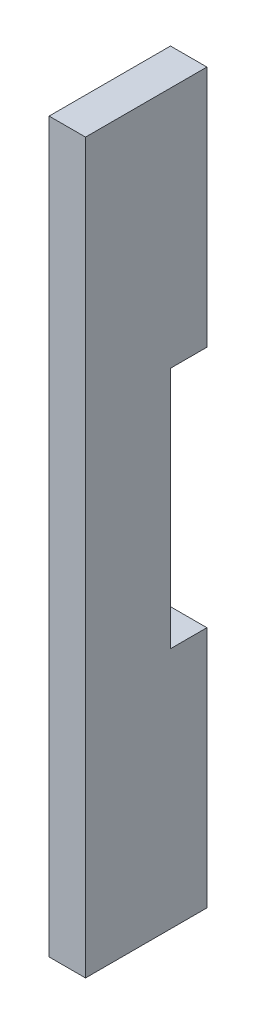
from build123d import *

# Parameters (mm, degrees)
CROQUIS1_W              = 20
CROQUIS1_H              = 120
SALIENTE_EXTRUIR1_DEPTH = 6
CROQUIS3_W              = 6.02
CROQUIS3_H              = 40.02
CORTAR_EXTRUIR1_DEPTH   = 122.803119829


with BuildPart() as part:
    # Croquis1 → Saliente-Extruir1 (new body)
    with BuildSketch(Plane(origin=(0, 0, 0), x_dir=(0, 0, -1), z_dir=(1, 0, 0))):
        with Locations((10, 60)):
            Rectangle(CROQUIS1_W, CROQUIS1_H)
    extrude(amount=SALIENTE_EXTRUIR1_DEPTH)

    # Croquis3 → Cortar-Extruir1 (cut, through all)
    with BuildSketch(Plane(origin=(0, 0, 0), x_dir=(0, 0, -1), z_dir=(1, 0, 0))):
        with Locations((16.99, 60)):
            Rectangle(CROQUIS3_W, CROQUIS3_H)
    extrude(amount=CORTAR_EXTRUIR1_DEPTH, mode=Mode.SUBTRACT)


solid = part.part
